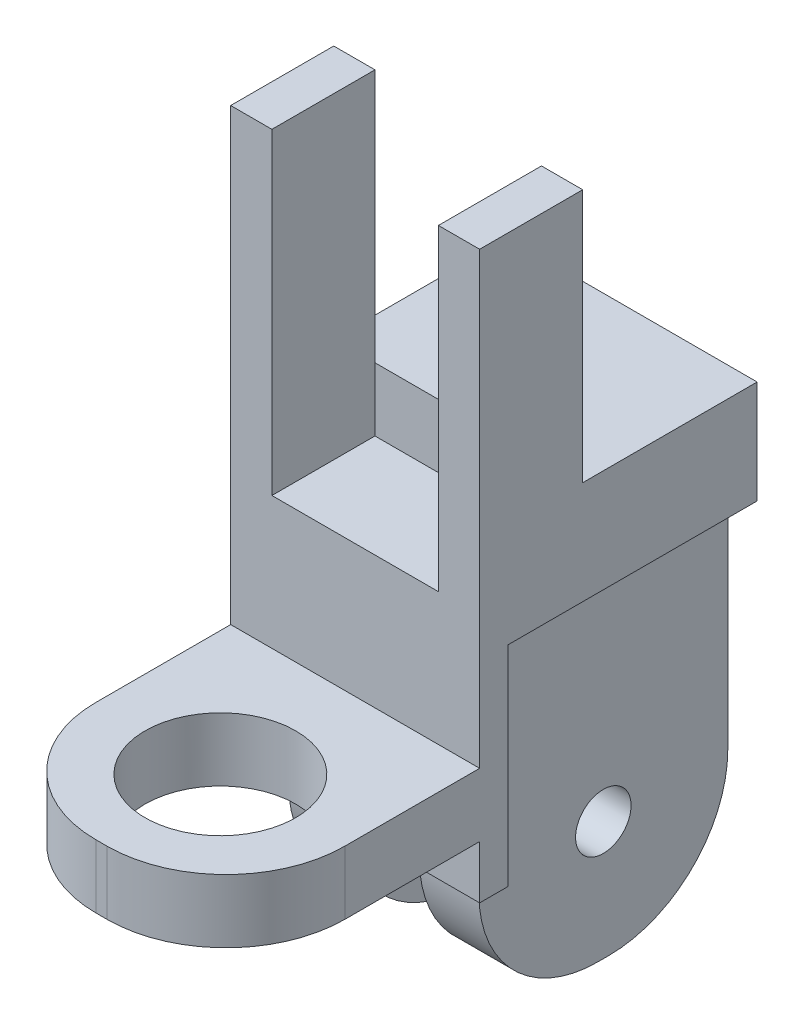
from build123d import *

# Parameters (mm, degrees)
SKETCH4_W            = 31.4
SKETCH4_H            = 31.4
SKETCH4_W_2          = 25.4
SKETCH4_H_2          = 25.4
BOSS_EXTRUDE3_DEPTH  = 30
SKETCH5_W            = 31.4
SKETCH5_H            = 31.4
BOSS_EXTRUDE4_DEPTH  = 5
SKETCH6_W            = 31.4
SKETCH6_H            = 8
BOSS_EXTRUDE5_DEPTH  = 5
BOSS_EXTRUDE6_DEPTH  = 8
SKETCH8_R            = 9.5
BOSS_EXTRUDE7_DEPTH  = 8
SKETCH9_W            = 31.4
SKETCH9_H            = 10
BOSS_EXTRUDE8_DEPTH  = 5
SKETCH10_W           = 31.4
SKETCH10_H           = 10
BOSS_EXTRUDE9_DEPTH  = 13
SKETCH11_W           = 5.2
SKETCH11_H           = 10
BOSS_EXTRUDE10_DEPTH = 40
BOSS_EXTRUDE11_DEPTH = 3
SKETCH13_W           = 31.4
SKETCH13_H           = 31.4
CUT_EXTRUDE1_DEPTH   = 31.4
SKETCH15_W           = 31.4
SKETCH15_H           = 13
BOSS_EXTRUDE12_DEPTH = 12
SKETCH17_W           = 7.5
SKETCH17_H           = 31.4
BOSS_EXTRUDE13_DEPTH = 10
SKETCH18_R           = 3.5
BOSS_EXTRUDE14_DEPTH = 7.5
SKETCH19_W           = 3.6
SKETCH19_H           = 5
CUT_EXTRUDE2_DEPTH   = 31.4
CUT_EXTRUDE3_START   = 8
SKETCH8_2_R          = 9.5
CUT_EXTRUDE3_DEPTH   = 24
SKETCH20_W           = 9
SKETCH20_H           = 1
CUT_EXTRUDE4_DEPTH   = 26.4


with BuildPart() as part:
    # Sketch4 → Boss-Extrude3 (new body)
    with BuildSketch(Plane.XY):
        Rectangle(SKETCH4_W, SKETCH4_H)
        Rectangle(SKETCH4_W_2, SKETCH4_H_2, mode=Mode.SUBTRACT)
    extrude(amount=BOSS_EXTRUDE3_DEPTH)

    # Sketch5 → Boss-Extrude4 (add)
    with BuildSketch(Plane.XY.offset(30)):
        Rectangle(SKETCH5_W, SKETCH5_H)
    extrude(amount=BOSS_EXTRUDE4_DEPTH)

    # Sketch6 → Boss-Extrude5 (add)
    with BuildSketch(Plane.XY.offset(35)):
        Rectangle(SKETCH6_W, SKETCH6_H)
    extrude(amount=BOSS_EXTRUDE5_DEPTH)

    # Sketch7 → Boss-Extrude6 (add)
    with BuildSketch(Plane.XZ.offset(4)):
        with BuildLine():
            Line((-15.7, 40), (-15.7, 52))
            ThreePointArc((-15.7, 52), (-11.306601718, 62.606601718), (-0.7, 67))
            Line((-0.7, 67), (0.7, 67))
            ThreePointArc((0.7, 67), (11.306601718, 62.606601718), (15.7, 52))
            Line((15.7, 52), (15.7, 40))
            Line((15.7, 40), (-15.7, 40))
        make_face()
    extrude(amount=-BOSS_EXTRUDE6_DEPTH)

    # Sketch8 → Boss-Extrude7 (add)
    with BuildSketch(Plane.XZ.offset(4)):
        with Locations((0, 52)):
            Circle(SKETCH8_R)
    boss_extrude7 = extrude(amount=BOSS_EXTRUDE7_DEPTH)

    # Mirror1: Boss-Extrude7 across plane
    add(boss_extrude7.mirror(Plane.ZX))

    # Sketch9 → Boss-Extrude8 (add)
    with BuildSketch(Plane(origin=(0, 15.7, 0), x_dir=(1, 0, 0), z_dir=(0, 1, 0))):
        with Locations((0, -27)):
            Rectangle(SKETCH9_W, SKETCH9_H)
    extrude(amount=BOSS_EXTRUDE8_DEPTH)

    # Sketch10 → Boss-Extrude9 (add)
    with BuildSketch(Plane(origin=(0, 15.7, 0), x_dir=(1, 0, 0), z_dir=(0, 1, 0))):
        with Locations((0, -17)):
            Rectangle(SKETCH10_W, SKETCH10_H)
    extrude(amount=BOSS_EXTRUDE9_DEPTH)

    # Sketch11 → Boss-Extrude10 (add)
    with BuildSketch(Plane(origin=(0, 20.7, 0), x_dir=(1, 0, 0), z_dir=(0, 1, 0))):
        with Locations((-13.1, -27)):
            Rectangle(SKETCH11_W, SKETCH11_H)
        with Locations((13.1, -27)):
            Rectangle(SKETCH11_W, SKETCH11_H)
    extrude(amount=BOSS_EXTRUDE10_DEPTH)

    # Sketch12 → Boss-Extrude11 (add)
    with BuildSketch(Plane.XY.offset(32)):
        Polygon((-15.7, 60.7), (-10.5, 60.7), (-10.5, 20.7), (10.5, 20.7), (10.5, 60.7), (15.7, 60.7), (15.7, 15.7), (-15.7, 15.7), align=None)
    extrude(amount=BOSS_EXTRUDE11_DEPTH)

    # Sketch13 → Cut-Extrude1 (cut)
    with BuildSketch(Plane.ZY.offset(15.7)):
        with Locations((15.7, 0)):
            Rectangle(SKETCH13_W, SKETCH13_H)
    extrude(amount=-CUT_EXTRUDE1_DEPTH, mode=Mode.SUBTRACT)

    # Sketch15 → Boss-Extrude12 (add)
    with BuildSketch(Plane(origin=(0, 0, 12), x_dir=(-1, 0, 0), z_dir=(0, 0, -1))):
        with Locations((0, 22.2)):
            Rectangle(SKETCH15_W, SKETCH15_H)
    extrude(amount=BOSS_EXTRUDE12_DEPTH)

    # Sketch17 → Boss-Extrude13 (add)
    with BuildSketch(Plane.XZ.offset(-15.7)):
        with Locations((-8.25, 15.7)):
            Rectangle(SKETCH17_W, SKETCH17_H)
    boss_extrude13 = extrude(amount=BOSS_EXTRUDE13_DEPTH)

    # Sketch18 → Boss-Extrude14 (add)
    with BuildSketch(Plane.ZY.offset(12)):
        with BuildLine():
            Line((31.4, 5.7), (0, 5.7))
            Line((0, 5.7), (0, -13.3))
            ThreePointArc((0, -13.3), (4.393398282, -23.906601718), (15, -28.3))
            Line((15, -28.3), (16.4, -28.3))
            ThreePointArc((16.4, -28.3), (27.006601718, -23.906601718), (31.4, -13.3))
            Line((31.4, -13.3), (31.4, 5.7))
        make_face()
        with Locations((15.7, -13.3)):
            Circle(SKETCH18_R, mode=Mode.SUBTRACT)
    boss_extrude14 = extrude(amount=-BOSS_EXTRUDE14_DEPTH)

    # Mirror3: Boss-Extrude13, Boss-Extrude14 across plane
    add(boss_extrude13.mirror(Plane(origin=(0, 0, 0), x_dir=(0, 0, 1), z_dir=(1, 0, 0))))
    add(boss_extrude14.mirror(Plane(origin=(0, 0, 0), x_dir=(0, 0, 1), z_dir=(1, 0, 0))))

    # Sketch19 → Cut-Extrude2 (cut)
    with BuildSketch(Plane(origin=(15.7, 0, 0), x_dir=(0, 0, -1), z_dir=(1, 0, 0))):
        with Locations((-33.2, -13.2)):
            Rectangle(SKETCH19_W, SKETCH19_H)
    extrude(amount=-CUT_EXTRUDE2_DEPTH, mode=Mode.SUBTRACT)

    # Sketch8<2> → Cut-Extrude3 (cut)
    with BuildSketch(Plane.XZ.offset(4).offset(CUT_EXTRUDE3_START)):
        with Locations((0, 52)):
            Circle(SKETCH8_2_R)
    extrude(amount=-CUT_EXTRUDE3_DEPTH, mode=Mode.SUBTRACT)

    # Sketch20 → Cut-Extrude4 (cut)
    with BuildSketch(Plane.XZ.offset(10.7)):
        with Locations((0, 31.9)):
            Rectangle(SKETCH20_W, SKETCH20_H)
    extrude(amount=-CUT_EXTRUDE4_DEPTH, mode=Mode.SUBTRACT)


solid = part.part
